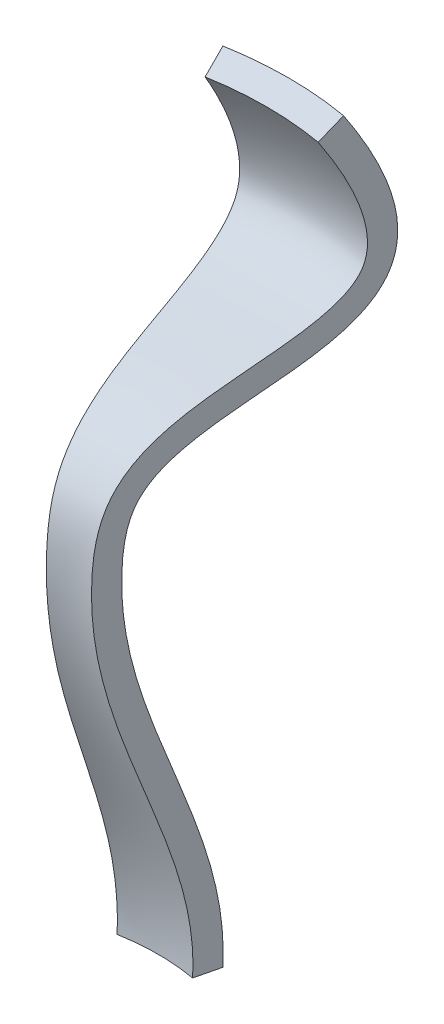
from build123d import *

# Parameters (mm, degrees)
CUT_EXTRUDE1_START = -508.0000001
CUT_EXTRUDE1_DEPTH = 508.0000001


# Read off the part's stored shape, not the designer's step: Cut-Extrude1
with BuildPart() as part:
    # Sketch1 → Revolve1 (revolve)
    with BuildSketch(Plane.XY, mode=Mode.PRIVATE) as revolve1_sk:
        with BuildLine():
            Line((254, 508), (237.94960875, 497.73903315))
            add(Edge.make_bspline(
                [(158.774116122, 0.9582498), (158.906059256, 3.577957878), (159.041855046, 8.831537013), (158.822295952, 19.283438624), (157.223619512, 37.555174995), (151.848734847, 63.759098736), (141.759684517, 95.702504612), (129.529728745, 128.325406067), (118.921601001, 156.277459688), (111.061022165, 179.264416306), (105.710012161, 196.865823803), (101.142650432, 214.87621139), (97.609371314, 233.337746941), (95.371233879, 252.284382394), (94.862813025, 266.856645649), (95.095372315, 276.731749911), (95.404023125, 283.326925958), (96.125217802, 291.898119682), (97.886358936, 302.565088775), (100.477705697, 311.637887464), (103.503956515, 318.855024425), (106.367946485, 324.237116263), (109.742115104, 329.270513356), (114.752753482, 335.402198506), (121.824020559, 342.033319193), (134.253074058, 350.716318141), (151.200908701, 358.773480038), (172.726659349, 365.963202326), (194.579899693, 371.954296696), (215.680927799, 377.703597717), (234.768057245, 383.959944661), (247.781564956, 389.990636007), (255.790348731, 395.250096044), (260.528585502, 399.334218979), (264.060261279, 403.523109905), (266.59637768, 407.950562574), (268.33640883, 413.03816338), (269.234054115, 419.370738135), (268.973773542, 427.413444828), (267.153749055, 437.392841343), (264.046838272, 447.37660533), (260.47437951, 456.367412796), (257.225001973, 463.612607895), (253.380729553, 471.361018489), (249.662926987, 478.238930179), (246.369427475, 483.995959061), (243.73793098, 488.440479186), (241.405992199, 492.254300903), (239.461479905, 495.362896898), (238.453099325, 496.95146402), (237.94960875, 497.73903315)],
                knots=[0, 0, 0, 0, 0.015625, 0.03125, 0.0625, 0.125, 0.1875, 0.25, 0.3125, 0.34375, 0.375, 0.40625, 0.4375, 0.46875, 0.5, 0.5078125, 0.515625, 0.53125, 0.546875, 0.5625, 0.5703125, 0.578125, 0.5859375, 0.59375, 0.609375, 0.625, 0.65625, 0.6875, 0.71875, 0.75, 0.78125, 0.8125, 0.828125, 0.84375, 0.859375, 0.875, 0.890625, 0.90625, 0.921875, 0.9375, 0.953125, 0.9609375, 0.96875, 0.9765625, 0.984375, 0.98828125, 0.9921875, 0.99609375, 0.998046875, 1, 1, 1, 1], degree=3))
            Line((158.774116122, 0.9582498), (177.8, 0))
            add(Edge.make_bspline(
                [(177.8, 0), (182.663049883, 96.555013501), (100.011054856, 190.789367992), (129.086362928, 387.003451887), (368.837595973, 328.368940617), (254, 508)],
                knots=[0, 0, 0, 0, 0.513600596, 0.576756418, 1, 1, 1, 1], degree=3))
        make_face()
    revolve(revolve1_sk.sketch.rotate(Axis((0, 0, 0), (0, 1, 0)), 90), axis=Axis((0, 0, 0), (0, 1, 0)))

    # Cut-Extrude1 outline → Cut-Extrude1 (cut)
    with BuildSketch(Plane(origin=(0, 508, 0), x_dir=(1, 0, 0), z_dir=(0, 1, 0)).offset(CUT_EXTRUDE1_START)):
        Polygon((4.9e-07, 0.00731364), (-50.01365737, 283.75992722), (-51.113519891, 290), (-290, 290), (-290, -290), (290, -290), (290, 290), (51.153550209, 290), (50.051644812, 283.753229095), align=None)
    extrude(amount=CUT_EXTRUDE1_DEPTH, mode=Mode.SUBTRACT)


solid = part.part
